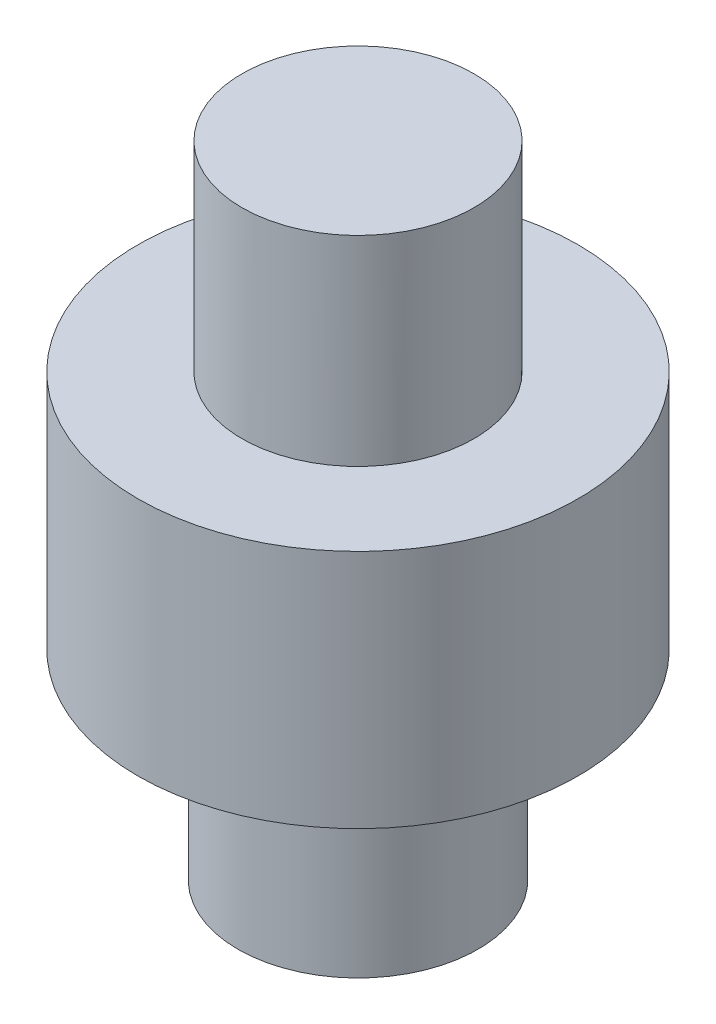
from build123d import *

# Parameters (mm, degrees)
SKETCH1_R           = 1.45
BOSS_EXTRUDE1_DEPTH = 2.5
SKETCH2_R           = 2.75
BOSS_EXTRUDE2_DEPTH = 3
SKETCH3_R           = 1.5
BOSS_EXTRUDE3_DEPTH = 2.5


with BuildPart() as part:
    # Sketch1 → Boss-Extrude1 (new body)
    with BuildSketch(Plane(origin=(0, 0, 0), x_dir=(1, 0, 0), z_dir=(0, 1, 0))):
        Circle(SKETCH1_R)
    extrude(amount=BOSS_EXTRUDE1_DEPTH)

    # Sketch2 → Boss-Extrude2 (add)
    with BuildSketch(Plane.XZ):
        Circle(SKETCH2_R)
    extrude(amount=BOSS_EXTRUDE2_DEPTH)

    # Sketch3 → Boss-Extrude3 (add)
    with BuildSketch(Plane.XZ.offset(3)):
        Circle(SKETCH3_R)
    extrude(amount=BOSS_EXTRUDE3_DEPTH)


solid = part.part
